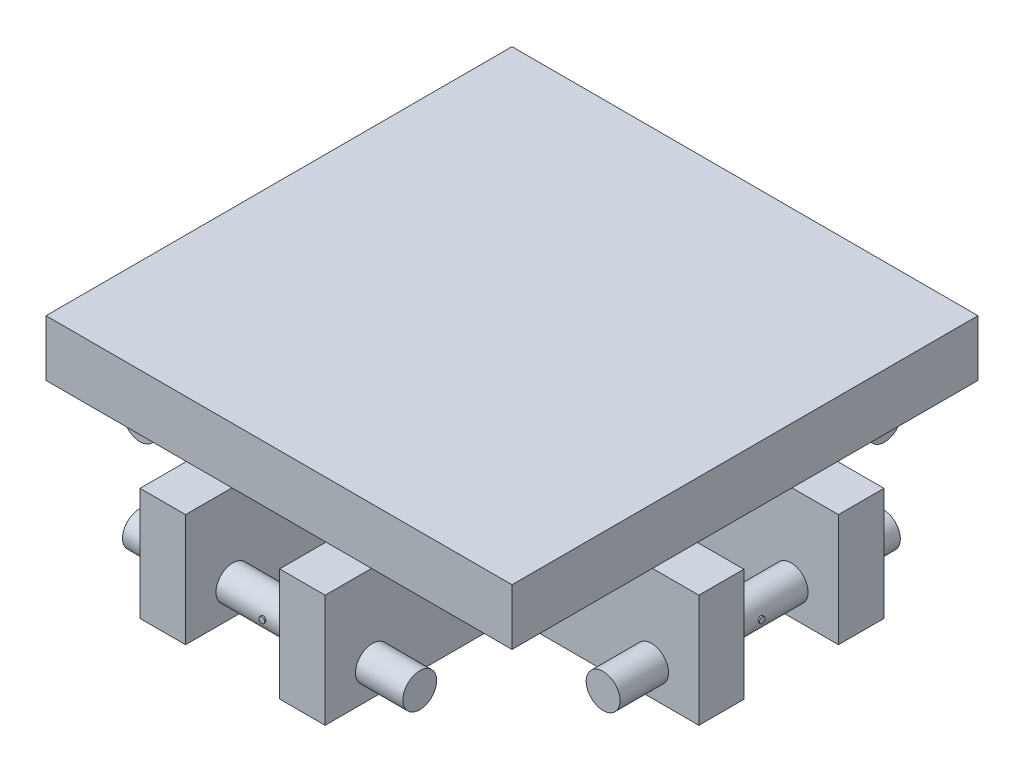
from build123d import *

# Parameters (mm, degrees)
SKETCH1_W                = 79.8
SKETCH1_H                = 79.8
BOSS_EXTRUDE1_DEPTH      = 9.6
BOSS_EXTRUDE2_DEPTH      = 19.3
BOSS_EXTRUDE3_DEPTH      = 32
BOSS_EXTRUDE3_DEPTH_BACK = 16
SKETCH4_R                = 2.9
BOSS_EXTRUDE4_DEPTH      = 32
BOSS_EXTRUDE4_DEPTH_BACK = 16
SKETCH5_R                = 2.9
BOSS_EXTRUDE5_DEPTH      = 32
BOSS_EXTRUDE5_DEPTH_BACK = 16
SKETCH6_R                = 2.9
BOSS_EXTRUDE6_DEPTH      = 32
BOSS_EXTRUDE6_DEPTH_BACK = 16
SKETCH7_R                = 2.9
SKETCH8_R                = 0.5
BOSS_EXTRUDE7_DEPTH      = 27.007470527
SKETCH10_R               = 0.5
BOSS_EXTRUDE9_DEPTH      = 27.01
BOSS_EXTRUDE10_START     = 27.01
SKETCH11_R               = 0.5
BOSS_EXTRUDE10_DEPTH     = 27.01
BOSS_EXTRUDE11_START     = 27.01
SKETCH13_R               = 0.5
BOSS_EXTRUDE11_DEPTH     = 27.01


with BuildPart() as part:
    # Sketch1 → Boss-Extrude1 (new body)
    with BuildSketch(Plane(origin=(0, 0, 0), x_dir=(1, 0, 0), z_dir=(0, 1, 0))):
        with Locations((-0.532, -4.965333333)):
            Rectangle(SKETCH1_W, SKETCH1_H)
    extrude(amount=BOSS_EXTRUDE1_DEPTH)

    # Sketch3 → Boss-Extrude2 (add)
    with BuildSketch(Plane.XZ):
        Polygon((-16.382, 20.815333333), (-46.539769302, 20.815333333), (-46.539769302, 13.115333333), (-16.382, 13.115333333), (-16.382, -3.084666667), (-48.382, -3.084666667), (-48.382, -10.884666667), (-16.382, -10.884666667), (-16.382, -42.884666667), (-8.582, -42.884666667), (-8.582, -10.884666667), (7.518, -10.884666667), (7.518, -42.884666667), (15.318, -42.884666667), (15.318, -10.884666667), (47.318, -10.884666667), (47.318, -3.084666667), (15.318, -3.084666667), (15.318, 13.115333333), (47.318, 13.115333333), (47.318, 20.815333333), (15.318, 20.815333333), (15.318, 52.815333333), (7.518, 52.815333333), (7.518, 20.815333333), (-8.582, 20.815333333), (-8.582, 52.815333333), (-16.382, 52.815333333), align=None)
    extrude(amount=BOSS_EXTRUDE2_DEPTH)

    # Sketch4 → Boss-Extrude3 (add, two sides: drawn at the far end of the back side and taken through both)
    with BuildSketch(Plane.XY.offset(-3.084666667).offset(-BOSS_EXTRUDE3_DEPTH_BACK)):
        with Locations((-40.282, -14.1)):
            Circle(SKETCH4_R)
    extrude(amount=BOSS_EXTRUDE3_DEPTH + BOSS_EXTRUDE3_DEPTH_BACK)

    # Sketch5 → Boss-Extrude4 (add, two sides: drawn at the far end of the back side and taken through both)
    with BuildSketch(Plane(origin=(-8.582, 0, 0), x_dir=(0, 0, -1), z_dir=(1, 0, 0)).offset(-BOSS_EXTRUDE4_DEPTH_BACK)):
        with Locations((-44.715333333, -14.1)):
            Circle(SKETCH5_R)
    extrude(amount=BOSS_EXTRUDE4_DEPTH + BOSS_EXTRUDE4_DEPTH_BACK)

    # Sketch6 → Boss-Extrude5 (add, two sides: drawn at the far end of the back side and taken through both)
    with BuildSketch(Plane(origin=(0, 0, 13.115333333), x_dir=(-1, 0, 0), z_dir=(0, 0, -1)).offset(-BOSS_EXTRUDE5_DEPTH_BACK)):
        with Locations((-39.218, -14.1)):
            Circle(SKETCH6_R)
    extrude(amount=BOSS_EXTRUDE5_DEPTH + BOSS_EXTRUDE5_DEPTH_BACK)

    # Sketch7 → Boss-Extrude6 (add, two sides: drawn at the far end of the back side and taken through both)
    with BuildSketch(Plane.ZY.offset(-7.518).offset(-BOSS_EXTRUDE6_DEPTH_BACK)):
        with Locations((-34.784666667, -14.1)):
            Circle(SKETCH7_R)
    extrude(amount=BOSS_EXTRUDE6_DEPTH + BOSS_EXTRUDE6_DEPTH_BACK)

    # Sketch8 → Boss-Extrude7 (add)
    with BuildSketch(Plane.XY.offset(20.815333333)):
        with Locations((-0.532, -14.1)):
            Circle(SKETCH8_R)
    extrude(amount=BOSS_EXTRUDE7_DEPTH)

    # Sketch10 → Boss-Extrude9 (add)
    with BuildSketch(Plane.ZY.offset(16.382)):
        with Locations((4.965333333, -14.1)):
            Circle(SKETCH10_R)
    extrude(amount=BOSS_EXTRUDE9_DEPTH)

    # Sketch11 → Boss-Extrude10 (add)
    with BuildSketch(Plane(origin=(15.318, 0, 0), x_dir=(0, 0, -1), z_dir=(1, 0, 0)).offset(BOSS_EXTRUDE10_START)):
        with Locations((-4.965333333, -14.1)):
            Circle(SKETCH11_R)
    extrude(amount=-BOSS_EXTRUDE10_DEPTH)

    # Sketch13 → Boss-Extrude11 (add)
    with BuildSketch(Plane(origin=(0, 0, -10.884666667), x_dir=(-1, 0, 0), z_dir=(0, 0, -1)).offset(BOSS_EXTRUDE11_START)):
        with Locations((0.532, -14.1)):
            Circle(SKETCH13_R)
    extrude(amount=-BOSS_EXTRUDE11_DEPTH)


solid = part.part
